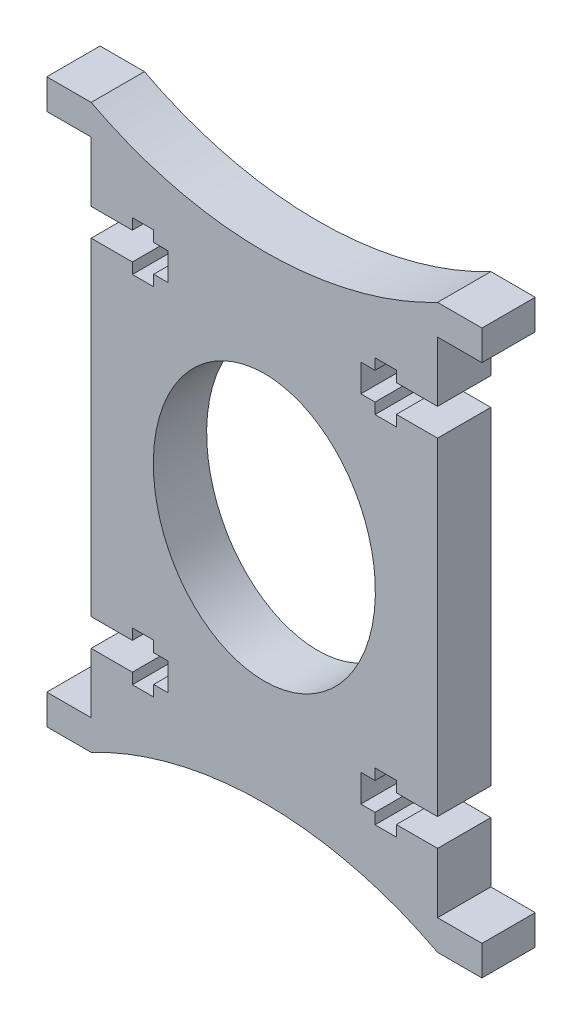
from build123d import *

# Parameters (mm, degrees)
SKETCH1_RX          = 15
SKETCH1_RY          = 12.5
BOSS_EXTRUDE1_DEPTH = 6


with BuildPart() as part:
    # Sketch1 → Boss-Extrude1 (new body)
    with BuildSketch(Plane.XY):
        with BuildLine():
            Line((733.980322055, 436.653824982), (736.380322055, 436.653824982))
            Line((736.380322055, 436.653824982), (736.380322055, 437.878226994))
            Line((736.380322055, 437.878226994), (741.018527083, 437.878226994))
            Line((741.018527083, 437.878226994), (741.018527083, 431.116067))
            Line((741.018527083, 431.116067), (746.018527083, 431.116067))
            Line((746.018527083, 431.116067), (746.018527083, 427.736067))
            Line((746.018527083, 427.736067), (741.018527083, 427.736067))
            ThreePointArc((741.018527083, 427.736067), (721.518527083, 432.537276697), (702.018527083, 427.736067))
            Line((702.018527083, 427.736067), (697.018527083, 427.736067))
            Line((697.018527083, 427.736067), (697.018527083, 431.116067))
            Line((697.018527083, 431.116067), (702.018527083, 431.116067))
            Line((702.018527083, 431.116067), (702.018527083, 437.878226994))
            Line((702.018527083, 437.878226994), (706.656732111, 437.878226994))
            Line((706.656732111, 437.878226994), (706.656732111, 436.653824982))
            Line((706.656732111, 436.653824982), (709.056732111, 436.653824982))
            Line((709.056732111, 436.653824982), (709.056732111, 437.878226994))
            Line((709.056732111, 437.878226994), (710.656732111, 437.878226994))
            Line((710.656732111, 437.878226994), (710.656732111, 440.973907006))
            Line((710.656732111, 440.973907006), (709.056732111, 440.973907006))
            Line((709.056732111, 440.973907006), (709.056732111, 442.198309018))
            Line((709.056732111, 442.198309018), (706.656732111, 442.198309018))
            Line((706.656732111, 442.198309018), (706.656732111, 440.973907006))
            Line((706.656732111, 440.973907006), (702.018527083, 440.973907006))
            Line((702.018527083, 440.973907006), (702.018527083, 459.426067))
            Line((702.018527083, 459.426067), (702.018527083, 477.878226994))
            Line((702.018527083, 477.878226994), (706.656732111, 477.878226994))
            Line((706.656732111, 477.878226994), (706.656732111, 476.653824982))
            Line((706.656732111, 476.653824982), (709.056732111, 476.653824982))
            Line((709.056732111, 476.653824982), (709.056732111, 477.878226994))
            Line((709.056732111, 477.878226994), (710.656732111, 477.878226994))
            Line((710.656732111, 477.878226994), (710.656732111, 480.973907006))
            Line((710.656732111, 480.973907006), (709.056732111, 480.973907006))
            Line((709.056732111, 480.973907006), (709.056732111, 482.198309018))
            Line((709.056732111, 482.198309018), (706.656732111, 482.198309018))
            Line((706.656732111, 482.198309018), (706.656732111, 480.973907006))
            Line((706.656732111, 480.973907006), (702.018527083, 480.973907006))
            Line((702.018527083, 480.973907006), (702.018527083, 487.736067))
            Line((702.018527083, 487.736067), (697.018527083, 487.736067))
            Line((697.018527083, 487.736067), (697.018527083, 491.116067))
            Line((697.018527083, 491.116067), (702.018527083, 491.116067))
            ThreePointArc((702.018527083, 491.116067), (721.518527083, 486.314857303), (741.018527083, 491.116067))
            Line((741.018527083, 491.116067), (746.018527083, 491.116067))
            Line((746.018527083, 491.116067), (746.018527083, 487.736067))
            Line((746.018527083, 487.736067), (741.018527083, 487.736067))
            Line((741.018527083, 487.736067), (741.018527083, 480.973907006))
            Line((741.018527083, 480.973907006), (736.380322055, 480.973907006))
            Line((736.380322055, 480.973907006), (736.380322055, 482.198309018))
            Line((736.380322055, 482.198309018), (733.980322055, 482.198309018))
            Line((733.980322055, 482.198309018), (733.980322055, 480.973907006))
            Line((733.980322055, 480.973907006), (732.380322055, 480.973907006))
            Line((732.380322055, 480.973907006), (732.380322055, 477.878226994))
            Line((732.380322055, 477.878226994), (733.980322055, 477.878226994))
            Line((733.980322055, 477.878226994), (733.980322055, 476.653824982))
            Line((733.980322055, 476.653824982), (736.380322055, 476.653824982))
            Line((736.380322055, 476.653824982), (736.380322055, 477.878226994))
            Line((736.380322055, 477.878226994), (741.018527083, 477.878226994))
            Line((741.018527083, 477.878226994), (741.018527083, 459.426067))
            Line((741.018527083, 459.426067), (741.018527083, 440.973907006))
            Line((741.018527083, 440.973907006), (736.380322055, 440.973907006))
            Line((736.380322055, 440.973907006), (736.380322055, 442.198309018))
            Line((736.380322055, 442.198309018), (733.980322055, 442.198309018))
            Line((733.980322055, 442.198309018), (733.980322055, 440.973907006))
            Line((733.980322055, 440.973907006), (732.380322055, 440.973907006))
            Line((732.380322055, 440.973907006), (732.380322055, 437.878226994))
            Line((732.380322055, 437.878226994), (733.980322055, 437.878226994))
            Line((733.980322055, 437.878226994), (733.980322055, 436.653824982))
        make_face()
        with Locations(Location((721.518527083, 459.426067), (0, 0, 90))):
            Ellipse(SKETCH1_RX, SKETCH1_RY, mode=Mode.SUBTRACT)
    extrude(amount=BOSS_EXTRUDE1_DEPTH)


solid = part.part
